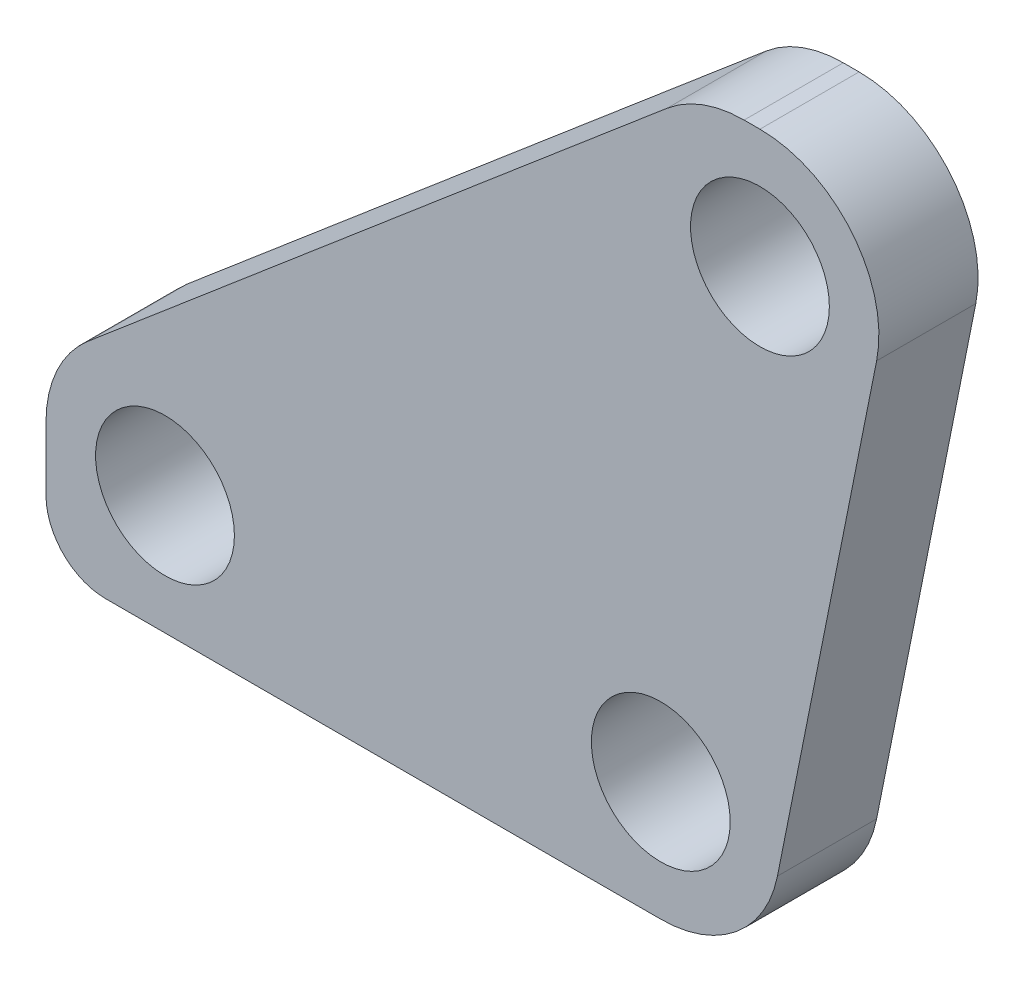
from build123d import *

# Parameters (mm, degrees)
SKETCH1_R          = 3.5
BASE_FLANGE1_DEPTH = 5


# Sheet-metal steps are written as plain solids
with BuildPart() as part:
    # Sketch1 → Base-Flange1 (new body)
    with BuildSketch(Plane.XY):
        with BuildLine():
            Line((-15.5, -6), (12.5, -6))
            ThreePointArc((12.5, -6), (16.303933434, -4.640052848), (18.383484054, -1.176696811))
            Line((18.383484054, -1.176696811), (23.383484054, 23.823303189))
            ThreePointArc((23.383484054, 23.823303189), (22.140052848, 28.803933434), (17.5, 31))
            Line((17.5, 31), (16.702465004, 31))
            ThreePointArc((16.702465004, 31), (14.634897456, 30.632509604), (12.820600314, 29.575054812))
            Line((12.820600314, 29.575054812), (-16.381864689, 4.797205718))
            ThreePointArc((-16.381864689, 4.797205718), (-17.944776769, 2.742945609), (-18.5, 0.222150906))
            Line((-18.5, 0.222150906), (-18.5, -3))
            ThreePointArc((-18.5, -3), (-17.621320344, -5.121320344), (-15.5, -6))
        make_face()
        with Locations((17.5, 25)):
            Circle(SKETCH1_R, mode=Mode.SUBTRACT)
        with Locations((12.5, 0)):
            Circle(SKETCH1_R, mode=Mode.SUBTRACT)
        with Locations((-12.5, 0)):
            Circle(SKETCH1_R, mode=Mode.SUBTRACT)
    extrude(amount=-BASE_FLANGE1_DEPTH)


solid = part.part
